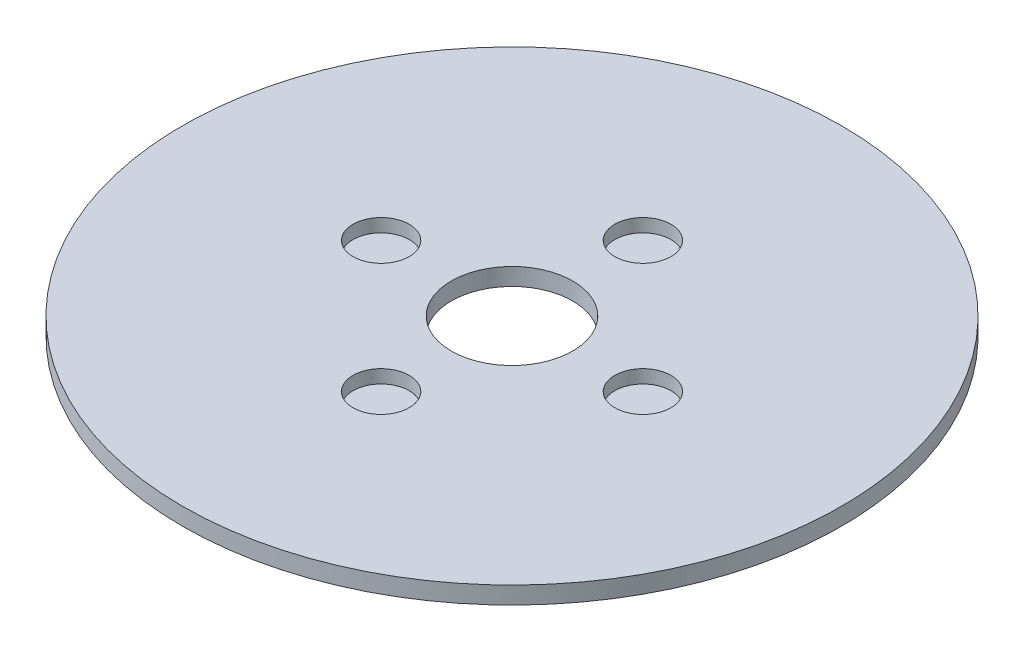
from build123d import *

# Parameters (mm, degrees)
SKETCH1_R           = 95
BOSS_EXTRUDE1_DEPTH = 5
SKETCH2_R           = 17.5
CUT_EXTRUDE1_DEPTH  = 135.443296597
SKETCH3_R           = 8.09397868
CUT_EXTRUDE2_DEPTH  = 3.83445823
CIRPATTERN1_COUNT   = 4


with BuildPart() as part:
    # Sketch1 → Boss-Extrude1 (new body)
    with BuildSketch(Plane(origin=(0, 0, 0), x_dir=(1, 0, 0), z_dir=(0, 1, 0))):
        Circle(SKETCH1_R)
    extrude(amount=BOSS_EXTRUDE1_DEPTH)

    # Sketch2 → Cut-Extrude1 (cut, through all)
    with BuildSketch(Plane(origin=(0, 0, 0), x_dir=(1, 0, 0), z_dir=(0, 1, 0))):
        Circle(SKETCH2_R)
    extrude(amount=CUT_EXTRUDE1_DEPTH, mode=Mode.SUBTRACT)

    # Sketch3 → Cut-Extrude2 (cut)
    with BuildSketch(Plane(origin=(0, 5, 0), x_dir=(1, 0, 0), z_dir=(0, 1, 0))):
        with Locations((-37.727326602, 0)):
            Circle(SKETCH3_R)
    cut_extrude2 = extrude(amount=-CUT_EXTRUDE2_DEPTH, mode=Mode.SUBTRACT)

    # CirPattern1: Cut-Extrude2 ×4 about axis
    cirpattern1_axis = Axis((0, 0, 0), (0, 1, 0))
    for i in range(1, CIRPATTERN1_COUNT):
        add(cut_extrude2.rotate(cirpattern1_axis, i * 360 / CIRPATTERN1_COUNT), mode=Mode.SUBTRACT)


solid = part.part
